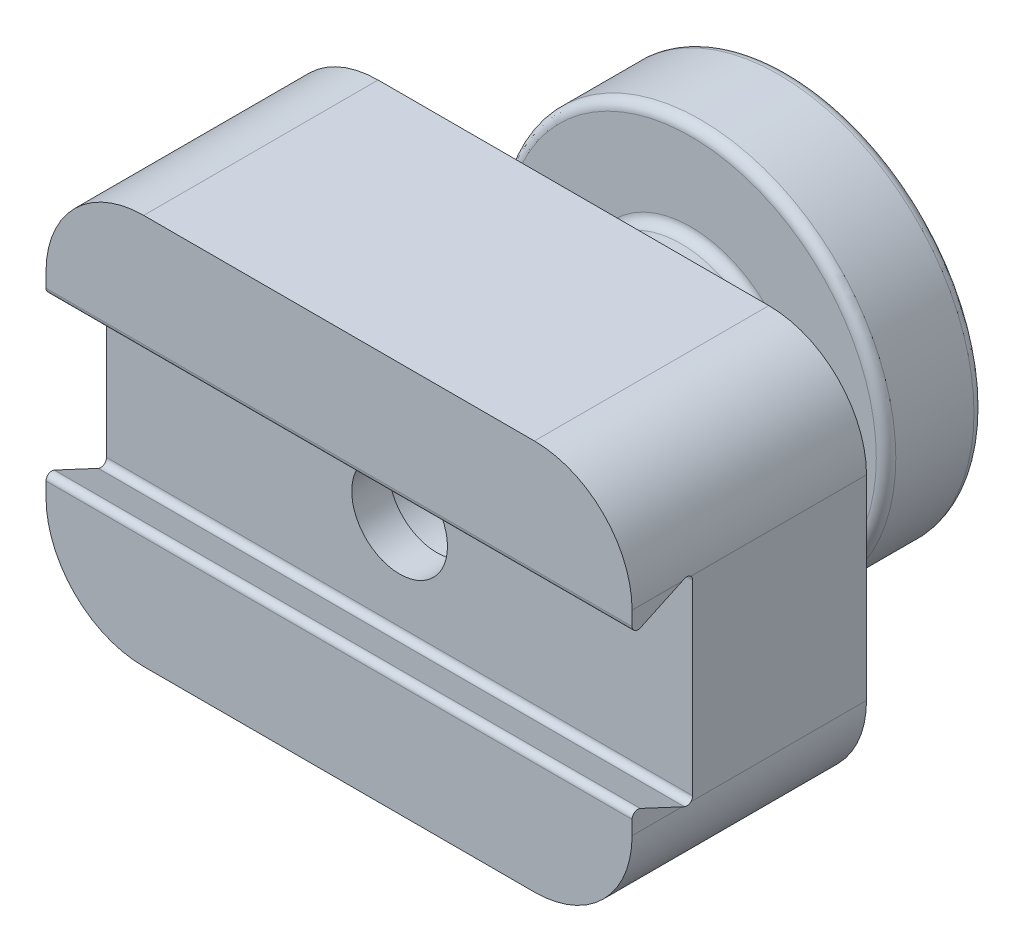
from build123d import *

# Parameters (mm, degrees)
BOSS_EXTRUDE1_DEPTH     = 5
SKETCH2_R               = 5
BOSS_EXTRUDE2_DEPTH     = 11
SKETCH3_W               = 30
SKETCH3_H               = 20
BOSS_EXTRUDE3_DEPTH     = 12
CUT_EXTRUDE1_DEPTH      = 36.411862419
CUT_EXTRUDE1_DEPTH_BACK = 36.411862419
SKETCH6_R               = 2.45
CUT_EXTRUDE2_DEPTH      = 5
FILLET1_R               = 0.3
FILLET2_R               = 5
FILLET3_R               = 0.5
SKETCH7_R               = 2.9
CUT_EXTRUDE3_DEPTH      = 6


with BuildPart() as part:
    # Sketch1 → Boss-Extrude1 (new body)
    with BuildSketch(Plane.XY):
        with BuildLine():
            ThreePointArc((10, 0), (0, 10), (-10, 0))
            ThreePointArc((-10, 0), (0, -10), (10, 0))
        make_face()
    extrude(amount=BOSS_EXTRUDE1_DEPTH)

    # Sketch2 → Boss-Extrude2 (add)
    with BuildSketch(Plane.XY):
        Circle(SKETCH2_R)
    extrude(amount=BOSS_EXTRUDE2_DEPTH)

    # Sketch3 → Boss-Extrude3 (add)
    with BuildSketch(Plane.XY.offset(11)):
        Rectangle(SKETCH3_W, SKETCH3_H)
    extrude(amount=BOSS_EXTRUDE3_DEPTH)

    # Sketch5 → Cut-Extrude1 (cut, two sides: drawn at the far end of the back side and taken through both)
    with BuildSketch(Plane(origin=(-10, 0, 0), x_dir=(0, 0, -1), z_dir=(1, 0, 0)).offset(-CUT_EXTRUDE1_DEPTH_BACK)):
        Polygon((-23, 3.80444626), (-19.9, 5.25), (-19.9, -5.25), (-23, -3.80444626), align=None)
    extrude(amount=CUT_EXTRUDE1_DEPTH + CUT_EXTRUDE1_DEPTH_BACK, mode=Mode.SUBTRACT)

    # Sketch6 → Cut-Extrude2 (cut)
    with BuildSketch(Plane.XY.offset(23)):
        Circle(SKETCH6_R)
    extrude(amount=-CUT_EXTRUDE2_DEPTH, mode=Mode.SUBTRACT)

    # Fillet1
    fillet1_edges = [part.edges().sort_by_distance(p)[0] for p in [
        (0, -5.25, 19.9),
        (0, -3.80444626, 23),
        (0, 5.25, 19.9),
        (0, 3.80444626, 23),
    ]]
    fillet(fillet1_edges, radius=FILLET1_R)

    # Fillet2
    fillet2_edges = [part.edges().sort_by_distance(p)[0] for p in [
        (-15, -10, 17),
        (15, -10, 17),
        (15, 10, 17),
        (-15, 10, 17),
    ]]
    fillet(fillet2_edges, radius=FILLET2_R)

    # Fillet3
    fillet3_edges = [part.edges().sort_by_distance(p)[0] for p in [
        (10, 0, 0),
        (10, 0, 5),
        (-5, 0, 5),
        (-5, 0, 11),
    ]]
    fillet(fillet3_edges, radius=FILLET3_R)

    # Sketch7 → Cut-Extrude3 (cut)
    with BuildSketch(Plane.XY.offset(18)):
        Circle(SKETCH7_R)
    extrude(amount=-CUT_EXTRUDE3_DEPTH, mode=Mode.SUBTRACT)


solid = part.part
